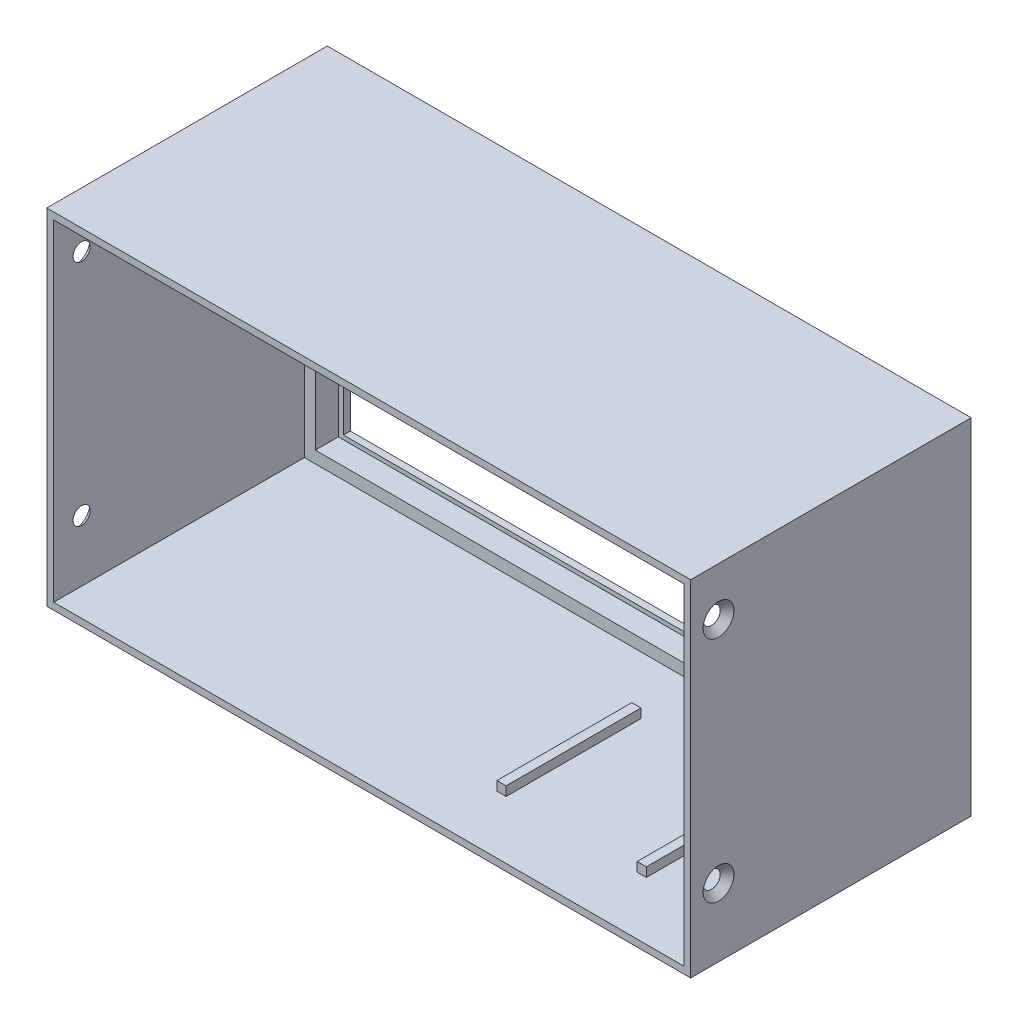
from build123d import *

# Parameters (mm, degrees)
SKETCH_1_W          = 140
SKETCH_1_H          = 75
EXTRUDE_1_DEPTH     = 61
SHELL_1_T           = -1.5
SKETCH_3_W          = 130
SKETCH_3_H          = 65
CUT_EXTRUDE_1_DEPTH = 117.308601118
SKETCH_4_W          = 137
SKETCH_4_H          = 2.6
SKETCH_4_H_2        = 3.3
EXTRUDE_2_DEPTH     = 5
SKETCH_5_W          = 2.4
SKETCH_5_H          = 69.4
EXTRUDE_3_DEPTH     = 5
SKETCH_29_W         = 2
SKETCH_29_H         = 29.319547491
EXTRUDE_4_DEPTH     = 2


# Read off the part's stored shape, not the designer's step: M3 六角凹锥坑螺钉的锥形沉头孔1, M3 六角凹锥坑螺钉的锥形沉头孔2
with BuildPart() as part:
    # 草图1 → 凸台-拉伸1 (new body)
    with BuildSketch(Plane.XY):
        with Locations((19.248188406, -5.412137681)):
            Rectangle(SKETCH_1_W, SKETCH_1_H)
    extrude(amount=EXTRUDE_1_DEPTH)

    # 抽壳1
    shell_1_openings = [part.faces().sort_by_distance(p)[0] for p in [
        (19.248188406, -5.412137681, 61),
    ]]
    offset(amount=SHELL_1_T, openings=shell_1_openings, kind=Kind.INTERSECTION)

    # 草图3 → 切除-拉伸1 (cut, through all)
    with BuildSketch(Plane(origin=(0, 0, 0), x_dir=(-1, 0, 0), z_dir=(0, 0, -1))):
        with Locations((-19.248188406, -5.412137681)):
            Rectangle(SKETCH_3_W, SKETCH_3_H)
    extrude(amount=-CUT_EXTRUDE_1_DEPTH, mode=Mode.SUBTRACT)

    # 草图4 → 凸台-拉伸2 (add)
    with BuildSketch(Plane.XY.offset(1.5)):
        with Locations((19.248188406, -40.112137681)):
            Rectangle(SKETCH_4_W, SKETCH_4_H)
        with Locations((19.248188406, 28.937862319)):
            Rectangle(SKETCH_4_W, SKETCH_4_H_2)
    extrude(amount=EXTRUDE_2_DEPTH)

    # 草图5 → 凸台-拉伸3 (add)
    with BuildSketch(Plane.XY.offset(1.5)):
        with Locations((-48.051811594, -4.112137681)):
            Rectangle(SKETCH_5_W, SKETCH_5_H)
        with Locations((86.548188406, -4.112137681)):
            Rectangle(SKETCH_5_W, SKETCH_5_H)
    extrude(amount=EXTRUDE_3_DEPTH)

    # M3 六角凹锥坑螺钉的锥形沉头孔1 outline → M3 六角凹锥坑螺钉的锥形沉头孔1 (revolve, cut)
    with BuildSketch(Plane(origin=(0, -28.118319618, 54.934676649), x_dir=(0, 1, 0), z_dir=(0, 0, -1))):
        Polygon((0, -50.751811594), (3.36, -50.751811594), (1.86, -49.251811594), (0, -49.251811594), align=None)
    revolve(axis=Axis((0, -28.118319618, 54.934676649), (1, 0, 0)), mode=Mode.SUBTRACT)

    # Hole Wizard M3 _1 2 outline → Hole Wizard M3 _1 2 (revolve, cut)
    with BuildSketch(Plane(origin=(0, 21.583463225, 54.934676649), x_dir=(0, 1, 0), z_dir=(0, 0, -1))):
        Polygon((0, -50.751811594), (3.36, -50.751811594), (1.86, -49.251811594), (0, -49.251811594), align=None)
    revolve(axis=Axis((0, 21.583463225, 54.934676649), (1, 0, 0)), mode=Mode.SUBTRACT)

    # M3 六角凹锥坑螺钉的锥形沉头孔2 outline → M3 六角凹锥坑螺钉的锥形沉头孔2 (revolve, cut)
    with BuildSketch(Plane(origin=(0, -28.118319618, 54.934676649), x_dir=(0, 1, 0), z_dir=(0, 0, -1))):
        Polygon((3.36, 89.248188406), (0, 89.248188406), (0, 87.748188406), (1.86, 87.748188406), align=None)
    revolve(axis=Axis((0, -28.118319618, 54.934676649), (1, 0, 0)), mode=Mode.SUBTRACT)

    # Hole Wizard M3 _2 2 outline → Hole Wizard M3 _2 2 (revolve, cut)
    with BuildSketch(Plane(origin=(0, 21.583463225, 54.934676649), x_dir=(0, 1, 0), z_dir=(0, 0, -1))):
        Polygon((3.36, 89.248188406), (0, 89.248188406), (0, 87.748188406), (1.86, 87.748188406), align=None)
    revolve(axis=Axis((0, 21.583463225, 54.934676649), (1, 0, 0)), mode=Mode.SUBTRACT)

    # 草图29 → 凸台-拉伸4 (add)
    with BuildSketch(Plane(origin=(0, -41.412137681, 0), x_dir=(1, 0, 0), z_dir=(0, 1, 0))):
        with Locations((35.5, -33.722670624)):
            Rectangle(SKETCH_29_W, SKETCH_29_H)
        with Locations((66, -33.722670624)):
            Rectangle(SKETCH_29_W, SKETCH_29_H)
    extrude(amount=EXTRUDE_4_DEPTH)


solid = part.part
